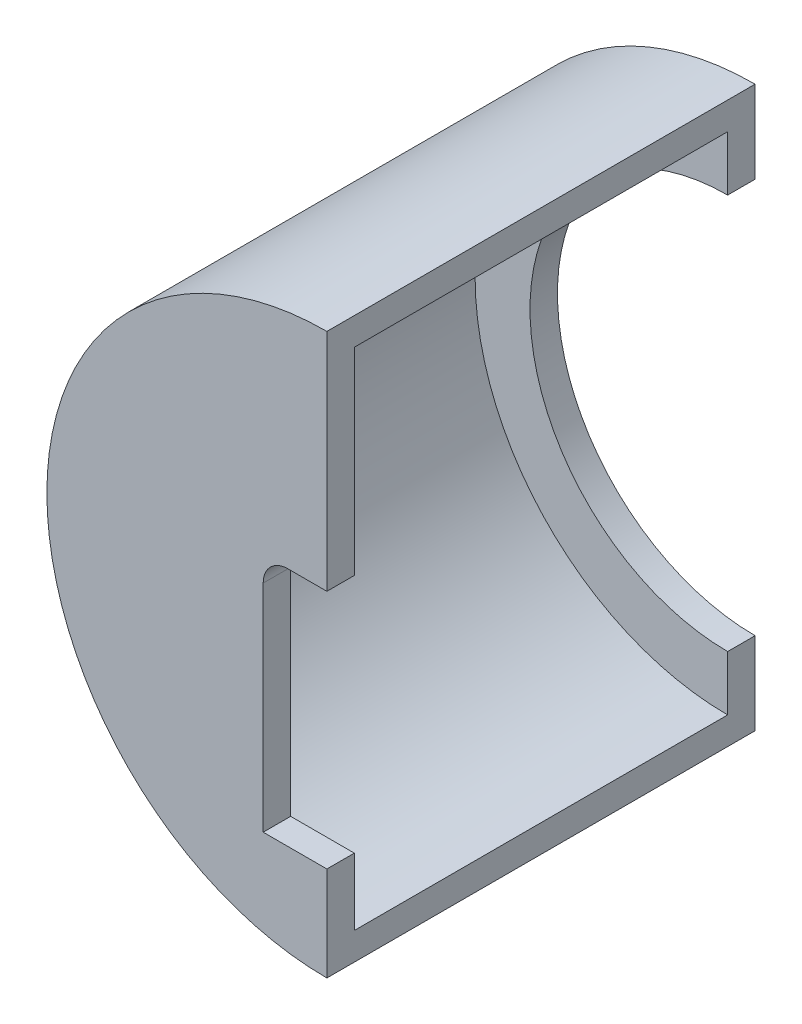
from build123d import *

# Parameters (mm, degrees)
BOSS_EXTRU_1_DEPTH      = 34
BOSS_EXTRU_2_START      = 5
BOSS_EXTRU_2_DEPTH      = 5
BOSS_EXTRU_3_DEPTH      = 5
ENL_V_MAT_EXTRU_1_DEPTH = 10


with BuildPart() as part:
    # Esquisse1 → Boss.-Extru.1 (new, symmetric)
    with BuildSketch(Plane.XY):
        with BuildLine():
            Line((0, 51), (0, 46))
            ThreePointArc((0, 46), (-46, 0), (0, -46))
            Line((0, -46), (0, -51))
            ThreePointArc((0, -51), (-51, 0), (0, 51))
        make_face()
    extrude(amount=BOSS_EXTRU_1_DEPTH, both=True)

    # Esquisse2 → Boss.-Extru.2 (add)
    with BuildSketch(Plane.XY.offset(34).offset(BOSS_EXTRU_2_START)):
        with BuildLine():
            Line((0, 51), (0, -51))
            ThreePointArc((0, -51), (-51, 0), (0, 51))
        make_face()
    extrude(amount=-BOSS_EXTRU_2_DEPTH)

    # Esquisse3 → Boss.-Extru.3 (add)
    with BuildSketch(Plane(origin=(0, 0, -34), x_dir=(-1, 0, 0), z_dir=(0, 0, -1))):
        with BuildLine():
            Line((0, 51), (0, 36))
            ThreePointArc((0, 36), (36, 0), (0, -36))
            Line((0, -36), (0, -51))
            ThreePointArc((0, -51), (51, 0), (0, 51))
        make_face()
    extrude(amount=BOSS_EXTRU_3_DEPTH)

    # Esquisse4 → Enlèv. mat.-Extru.1 (cut)
    with BuildSketch(Plane.XY.offset(39)):
        with BuildLine():
            Line((-11.59999996, 5.499999956), (-11.59999996, -33.8))
            Line((-11.59999996, -33.8), (0, -33.8))
            Line((0, -33.8), (0, -2.15))
            ThreePointArc((0, -2.15), (2.15, 0), (0, 2.15))
            Line((0, 2.15), (0, 10.000000044))
            Line((0, 10.000000044), (-7.099999871, 10.000000044))
            ThreePointArc((-7.099999871, 10.000000044), (-10.281980449, 8.681980534), (-11.59999996, 5.499999956))
        make_face()
    extrude(amount=-ENL_V_MAT_EXTRU_1_DEPTH, mode=Mode.SUBTRACT)


solid = part.part
